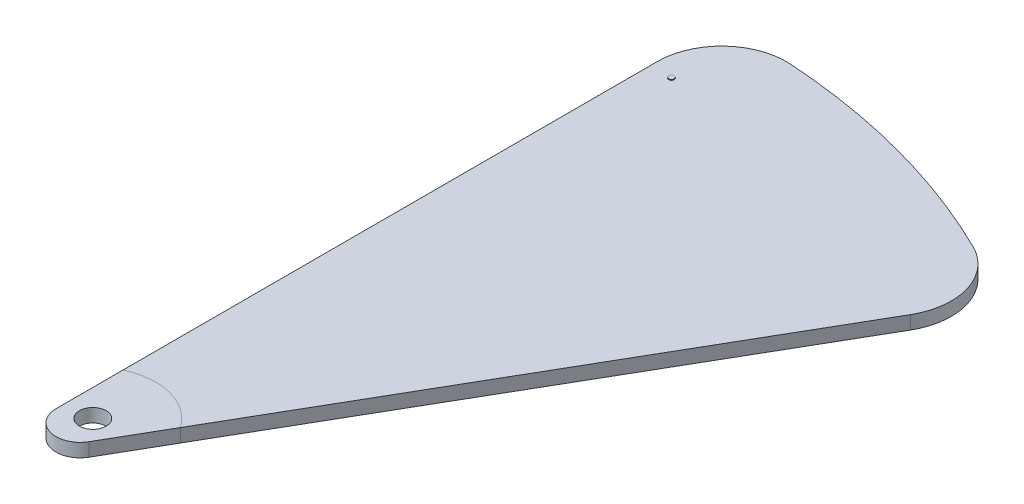
from build123d import *
from build123d.topology import SkipClean

# Parameters (mm, degrees)
SKETCH1_R           = 50
BOSS_EXTRUDE1_DEPTH = 50
SKETCH4_R           = 10
BOSS_EXTRUDE3_DEPTH = 3
CUT_EXTRUDE2_DEPTH  = 0.5
BOSS_EXTRUDE4_DEPTH = 0.2
BOSS_EXTRUDE5_DEPTH = 0.2
BOSS_EXTRUDE6_START = 0.2
SKETCH7_R           = 50
BOSS_EXTRUDE6_DEPTH = 0.2
SCALE1_SCALE        = 0.4


# Read off the part's stored shape, not the designer's step: Boss-Extrude5
with BuildPart() as part:
    # Sketch1 → Boss-Extrude1 (new body)
    with BuildSketch(Plane(origin=(0, 0, 0), x_dir=(1, 0, 0), z_dir=(0, 1, 0))):
        with BuildLine():
            Line((-100, -37.320508076), (-100, 2205.561153086))
            ThreePointArc((-100, 2205.561153086), (-24.242398944, 2380.559537047), (155.20361991, 2445.079106362))
            ThreePointArc((155.20361991, 2445.079106362), (634.106660501, 2366.518274408), (1088.12927558, 2195.102430327))
            ThreePointArc((1088.12927558, 2195.102430327), (1211.274301858, 2049.503834832), (1189.383116921, 1860.071988172))
            Line((1189.383116921, 1860.071988172), (67.942286341, -82.320508076))
            ThreePointArc((67.942286341, -82.320508076), (-33.293714059, -124.253832442), (-100, -37.320508076))
        make_face()
        with Locations(Location((0, 0, 0), (0, 0, 270))):
            Circle(SKETCH1_R, mode=Mode.SUBTRACT)
    extrude(amount=BOSS_EXTRUDE1_DEPTH)

    # Sketch4 → Boss-Extrude3 (add)
    with BuildSketch(Plane(origin=(0, 50, 0), x_dir=(1, 0, 0), z_dir=(0, 1, 0))):
        with Locations(Location((-20, 2177.943552918, 0), (0, 0, 270))):
            Circle(SKETCH4_R)
    extrude(amount=BOSS_EXTRUDE3_DEPTH)

    # Sketch3 → Cut-Extrude2 (cut)
    with BuildSketch(Plane.XZ):
        with BuildLine():
            ThreePointArc((-20.091825873, -2187.943131309), (596.52071885, -2105.151267556), (1164.905031596, -1852.15957592))
            ThreePointArc((1164.905031596, -1852.15957592), (1168.045997919, -1838.370655347), (1154.257077346, -1835.229689025))
            ThreePointArc((1154.257077346, -1835.229689025), (591.068149626, -2085.90887974), (-19.908174127, -2167.943974526))
            ThreePointArc((-19.908174127, -2167.943974526), (-29.999578392, -2177.851727045), (-20.091825873, -2187.943131309))
        make_face()
    extrude(amount=-CUT_EXTRUDE2_DEPTH, mode=Mode.SUBTRACT)

    # Sketch5 → Boss-Extrude4 (add)
    with BuildSketch(Plane.XZ):
        Polygon((542.547945003, -2273.925316947), (586.315782382, -2349.733435026), (767.353015686, -2247.606927353), (794.77422197, -2295.101849842), (801.604348989, -2296.931976861), (981.604348989, -2193.008928407), (1105.934476008, -2121.226896104), (1078.27364816, -2073.316936892), (1198.27364816, -2004.034904589), (166.83416305, -217.529311446), (38.173909012, -291.811343748), (121.032197487, -435.326109216), (-58.967802513, -539.24915767), (61.032197487, -747.095254578), (-58.967802513, -816.377286881), (81.037336135, -1058.87330034), (-38.962663865, -1128.155332642), (89.271984354, -1350.264258649), (-30.728015646, -1419.546290952), (69.606816867, -1593.331318633), (-50.393183133, -1662.613350936), (59.706400881, -1853.31142434), (-55.9634721, -1920.093456643), (-60.293599119, -1922.593456643), (21.112159322, -2063.592366291), (-98.887840678, -2132.874398594), (36.804486202, -2367.900402947), (96.804486202, -2333.259386796), (134.304486202, -2398.21129208), (141.134613221, -2400.041419098), (256.804486202, -2333.259386796), (302.547945003, -2412.489381553), align=None)
        Polygon((191.804486202, -2359.240148909), (140.46474024, -2388.881165061), (-25.22758664, -2101.89363648), (26.112159322, -2072.252620329), align=None, mode=Mode.SUBTRACT)
        Polygon((91.804486202, -2324.599132758), (40.46474024, -2354.240148909), (-85.22758664, -2136.534652631), (-33.887840678, -2106.89363648), align=None, mode=Mode.SUBTRACT)
        Polygon((74.692451525, -750.755508616), (126.032197487, -721.114492465), (972.27422197, -2186.848674369), (920.934476008, -2216.489690521), align=None, mode=Mode.SUBTRACT)
        Polygon((14.692451525, -785.396524767), (66.032197487, -755.755508616), (912.27422197, -2221.489690521), (860.934476008, -2251.130706672), align=None, mode=Mode.SUBTRACT)
        Polygon((74.692451525, -473.627379405), (126.032197487, -443.986363254), (1092.27422197, -2117.566642067), (1040.934476008, -2147.207658218), align=None, mode=Mode.SUBTRACT)
        Polygon((14.692451525, -508.268395556), (66.032197487, -478.627379405), (1032.27422197, -2152.207658218), (980.934476008, -2181.848674369), align=None, mode=Mode.SUBTRACT)
        Polygon((4.706400881, -1896.612694529), (-46.633345081, -1926.253710681), (29.77241336, -2058.592366291), (81.112159322, -2028.951350139), align=None, mode=Mode.SUBTRACT)
        Polygon((710.717180166, -2268.074847309), (762.352766652, -2238.946241976), (86.037336135, -1067.533554377), (34.697590173, -1097.174570529), align=None, mode=Mode.SUBTRACT)
        Polygon((486.20819904, -2294.906079061), (537.547945003, -2265.265062909), (34.271984354, -1393.565528838), (-17.067761608, -1423.20654499), align=None, mode=Mode.SUBTRACT)
        Polygon((650.371435731, -2302.117016533), (702.007022217, -2272.9884112), (26.037336135, -1102.174570529), (-25.302409827, -1131.81558668), align=None, mode=Mode.SUBTRACT)
        Polygon((357.547945003, -2369.188111363), (306.20819904, -2398.829127515), (13.366654919, -1891.612694529), (64.706400881, -1861.971678378), align=None, mode=Mode.SUBTRACT)
        Polygon((86.112159322, -2037.611604177), (251.804486202, -2324.599132758), (200.46474024, -2354.240148909), (34.77241336, -2067.252620329), align=None, mode=Mode.SUBTRACT)
        Polygon((42.932238392, -1388.565528838), (94.271984354, -1358.924512687), (641.661277783, -2307.030580425), (590.025691297, -2336.159185758), align=None, mode=Mode.SUBTRACT)
        Polygon((-36.732929095, -1666.273604974), (366.20819904, -2364.188111363), (417.547945003, -2334.547095212), (14.606816867, -1636.632588823), align=None, mode=Mode.SUBTRACT)
        Polygon((112.92217463, -262.715072971), (164.261920592, -233.07405682), (1184.613394122, -2000.374650551), (1133.27364816, -2030.015666702), align=None, mode=Mode.SUBTRACT)
        Polygon((104.401991454, -267.957682821), (1124.613394122, -2035.015666702), (1073.27364816, -2064.656682854), (53.062245492, -297.598698973), align=None, mode=Mode.SUBTRACT)
        Polygon((6.032197487, -513.268395556), (121.032197487, -712.454238427), (69.692451525, -742.095254578), (-45.307548475, -542.909411708), align=None, mode=Mode.SUBTRACT)
        Polygon((6.032197487, -790.396524767), (852.27422197, -2256.130706672), (800.934476008, -2285.771722823), (-45.307548475, -820.037540919), align=None, mode=Mode.SUBTRACT)
        Polygon((23.267070905, -1631.632588823), (426.20819904, -2329.547095212), (477.547945003, -2299.906079061), (74.606816867, -1601.991572671), align=None, mode=Mode.SUBTRACT)
    extrude(amount=-BOSS_EXTRUDE4_DEPTH)

    # Boss-Extrude5 outline → Boss-Extrude5 (add)
    with BuildSketch(Plane.XZ):
        with BuildLine():
            ThreePointArc((234.09429984, -2155.360125562), (239.520378802, -2154.763885028), (244.944939335, -2154.153984462))
            Line((244.944939335, -2154.153984462), (-36.732929095, -1666.273604974))
            Line((-36.732929095, -1666.273604974), (14.606816867, -1636.632588823))
            Line((14.606816867, -1636.632588823), (308.661879703, -2145.950897877))
            ThreePointArc((308.661879703, -2145.950897877), (313.98647166, -2145.178292752), (319.309129869, -2144.392476126))
            Line((319.309129869, -2144.392476126), (23.267070905, -1631.632588823))
            Line((23.267070905, -1631.632588823), (74.606816867, -1601.991572671))
            Line((74.606816867, -1601.991572671), (381.845295224, -2134.144227225))
            ThreePointArc((381.845295224, -2134.144227225), (387.072476461, -2133.202360314), (392.297334581, -2132.247690434))
            Line((392.297334581, -2132.247690434), (-17.067761608, -1423.20654499))
            Line((-17.067761608, -1423.20654499), (34.271984354, -1393.565528838))
            Line((34.271984354, -1393.565528838), (453.697623881, -2120.032046495))
            ThreePointArc((453.697623881, -2120.032046495), (458.830885306, -2118.926999868), (463.961455319, -2117.809524027))
            Line((463.961455319, -2117.809524027), (42.932238392, -1388.565528838))
            Line((42.932238392, -1388.565528838), (94.271984354, -1358.924512687))
            Line((94.271984354, -1358.924512687), (524.264288743, -2103.693030751))
            ThreePointArc((524.264288743, -2103.693030751), (529.306614784, -2102.430003502), (534.345898088, -2101.154890359))
            Line((534.345898088, -2101.154890359), (-25.302409827, -1131.81558668))
            Line((-25.302409827, -1131.81558668), (26.037336135, -1102.174570529))
            Line((26.037336135, -1102.174570529), (593.584056893, -2085.194326552))
            ThreePointArc((593.584056893, -2085.194326552), (598.537988348, -2083.777744527), (603.488539208, -2082.349393144))
            Line((603.488539208, -2082.349393144), (34.697590173, -1097.174570529))
            Line((34.697590173, -1097.174570529), (86.037336135, -1067.533554377))
            Line((86.037336135, -1067.533554377), (661.689835953, -2064.592931567))
            ThreePointArc((661.689835953, -2064.592931567), (666.557520224, -2063.026535049), (671.42149647, -2061.448662024))
            Line((671.42149647, -2061.448662024), (-45.307548475, -820.037540919))
            Line((-45.307548475, -820.037540919), (6.032197487, -790.396524767))
            Line((6.032197487, -790.396524767), (728.609310762, -2041.936797345))
            ThreePointArc((728.609310762, -2041.936797345), (733.392542002, -2040.22371112), (738.17174553, -2038.499420207))
            Line((738.17174553, -2038.499420207), (14.692451525, -785.396524767))
            Line((14.692451525, -785.396524767), (66.032197487, -755.755508616))
            Line((66.032197487, -755.755508616), (794.365451405, -2017.265709245))
            ThreePointArc((794.365451405, -2017.265709245), (799.065702466, -2015.40849835), (803.761611449, -2013.540335837))
            Line((803.761611449, -2013.540335837), (74.692451525, -750.755508616))
            Line((74.692451525, -750.755508616), (126.032197487, -721.114492465))
            Line((126.032197487, -721.114492465), (858.976915854, -1990.611983816))
            ThreePointArc((858.976915854, -1990.611983816), (863.595363434, -1988.612697419), (868.209157673, -1986.602695713))
            Line((868.209157673, -1986.602695713), (14.692451525, -508.268395556))
            Line((14.692451525, -508.268395556), (66.032197487, -478.627379405))
            Line((66.032197487, -478.627379405), (922.458364554, -1962.001013696))
            ThreePointArc((922.458364554, -1962.001013696), (926.995908595, -1959.861218946), (931.528489064, -1957.710930179))
            Line((931.528489064, -1957.710930179), (74.692451525, -473.627379405))
            Line((74.692451525, -473.627379405), (126.032197487, -443.986363254))
            Line((126.032197487, -443.986363254), (984.820699868, -1931.451682334))
            ThreePointArc((984.820699868, -1931.451682334), (989.277977987, -1929.172489528), (993.729981352, -1926.883010523))
            Line((993.729981352, -1926.883010523), (53.062245492, -297.598698973))
            Line((53.062245492, -297.598698973), (104.401991454, -267.957682821))
            Line((104.401991454, -267.957682821), (1046.071239752, -1898.976664798))
            ThreePointArc((1046.071239752, -1898.976664798), (1050.448637241, -1896.558744832), (1054.820445911, -1894.130734392))
            Line((1054.820445911, -1894.130734392), (112.92217463, -262.715072971))
            Line((112.92217463, -262.715072971), (164.261920592, -233.07405682))
            Line((164.261920592, -233.07405682), (1106.213832235, -1864.582626073))
            ThreePointArc((1106.213832235, -1864.582626073), (1110.511488019, -1862.02622083), (1114.803236108, -1859.459909986))
            Line((1114.803236108, -1859.459909986), (166.83416305, -217.529311446))
            Line((166.83416305, -217.529311446), (38.173909012, -291.811343748))
            Line((38.173909012, -291.811343748), (121.032197487, -435.326109216))
            Line((121.032197487, -435.326109216), (-58.967802513, -539.24915767))
            Line((-58.967802513, -539.24915767), (61.032197487, -747.095254578))
            Line((61.032197487, -747.095254578), (-58.967802513, -816.377286881))
            Line((-58.967802513, -816.377286881), (81.037336135, -1058.87330034))
            Line((81.037336135, -1058.87330034), (-38.962663865, -1128.155332642))
            Line((-38.962663865, -1128.155332642), (89.271984354, -1350.264258649))
            Line((89.271984354, -1350.264258649), (-30.728015646, -1419.546290952))
            Line((-30.728015646, -1419.546290952), (69.606816867, -1593.331318633))
            Line((69.606816867, -1593.331318633), (-50.393183133, -1662.613350936))
            Line((-50.393183133, -1662.613350936), (59.706400881, -1853.31142434))
            Line((59.706400881, -1853.31142434), (-60.293599119, -1922.593456643))
            Line((-60.293599119, -1922.593456643), (21.112159322, -2063.592366291))
            Line((21.112159322, -2063.592366291), (-98.887840678, -2132.874398594))
            Line((-98.887840678, -2132.874398594), (36.804486202, -2367.900402947))
            Line((36.804486202, -2367.900402947), (96.804486202, -2333.259386796))
            Line((96.804486202, -2333.259386796), (134.304486202, -2398.21129208))
            Line((134.304486202, -2398.21129208), (141.134613221, -2400.041419098))
            Line((141.134613221, -2400.041419098), (256.804486202, -2333.259386796))
            Line((256.804486202, -2333.259386796), (302.547945003, -2412.489381553))
            Line((302.547945003, -2412.489381553), (542.547945003, -2273.925316947))
            Line((542.547945003, -2273.925316947), (586.315782382, -2349.733435026))
            Line((586.315782382, -2349.733435026), (767.353015686, -2247.606927353))
            Line((767.353015686, -2247.606927353), (794.77422197, -2295.101849842))
            Line((794.77422197, -2295.101849842), (801.604348989, -2296.931976861))
            Line((801.604348989, -2296.931976861), (1105.934476008, -2121.226896104))
            Line((1105.934476008, -2121.226896104), (1078.27364816, -2073.316936892))
            Line((1078.27364816, -2073.316936892), (1198.27364816, -2004.034904589))
            Line((1198.27364816, -2004.034904589), (1124.804581071, -1876.782747606))
            ThreePointArc((1124.804581071, -1876.782747606), (1120.512481463, -1879.348452575), (1116.214529453, -1881.904341764))
            Line((1116.214529453, -1881.904341764), (1184.613394122, -2000.374650551))
            Line((1184.613394122, -2000.374650551), (1133.27364816, -2030.015666702))
            Line((1133.27364816, -2030.015666702), (1064.821633527, -1911.453299478))
            ThreePointArc((1064.821633527, -1911.453299478), (1060.450206779, -1913.881967691), (1056.073240703, -1916.300638622))
            Line((1056.073240703, -1916.300638622), (1124.613394122, -2035.015666702))
            Line((1124.613394122, -2035.015666702), (1073.27364816, -2064.656682854))
            Line((1073.27364816, -2064.656682854), (1003.74114875, -1944.222861098))
            ThreePointArc((1003.74114875, -1944.222861098), (999.290264402, -1946.514267808), (994.834149112, -1948.795485183))
            Line((994.834149112, -1948.795485183), (1092.27422197, -2117.566642067))
            Line((1092.27422197, -2117.566642067), (1040.934476008, -2147.207658218))
            Line((1040.934476008, -2147.207658218), (941.559864753, -1975.085782541))
            ThreePointArc((941.559864753, -1975.085782541), (937.029150852, -1977.239286926), (932.493511562, -1979.382398175))
            Line((932.493511562, -1979.382398175), (1032.27422197, -2152.207658218))
            Line((1032.27422197, -2152.207658218), (980.934476008, -2181.848674369))
            Line((980.934476008, -2181.848674369), (878.271156695, -2004.030589245))
            ThreePointArc((878.271156695, -2004.030589245), (873.659994101, -2006.045124622), (869.044210702, -2008.049049987))
            Line((869.044210702, -2008.049049987), (972.27422197, -2186.848674369))
            Line((972.27422197, -2186.848674369), (920.934476008, -2216.489690521))
            Line((920.934476008, -2216.489690521), (813.864935364, -2031.039806182))
            ThreePointArc((813.864935364, -2031.039806182), (809.17244816, -2032.913863509), (804.475645675, -2034.777079394))
            Line((804.475645675, -2034.777079394), (912.27422197, -2221.489690521))
            Line((912.27422197, -2221.489690521), (860.934476008, -2251.130706672))
            Line((860.934476008, -2251.130706672), (748.327489967, -2056.089685561))
            ThreePointArc((748.327489967, -2056.089685561), (743.552531613, -2057.821289627), (738.773566433, -2059.541804589))
            Line((738.773566433, -2059.541804589), (852.27422197, -2256.130706672))
            Line((852.27422197, -2256.130706672), (800.934476008, -2285.771722823))
            Line((800.934476008, -2285.771722823), (681.641269397, -2079.149827974))
            ThreePointArc((681.641269397, -2079.149827974), (676.782404105, -2080.736505376), (671.919845508, -2082.311827878))
            Line((671.919845508, -2082.311827878), (762.352766652, -2238.946241976))
            Line((762.352766652, -2238.946241976), (710.717180166, -2268.074847309))
            Line((710.717180166, -2268.074847309), (613.784593627, -2100.182682515))
            ThreePointArc((613.784593627, -2100.182682515), (608.840072242, -2101.621420176), (603.892178453, -2103.048516824))
            Line((603.892178453, -2103.048516824), (702.007022217, -2272.9884112))
            Line((702.007022217, -2272.9884112), (650.371435731, -2302.117016533))
            Line((650.371435731, -2302.117016533), (544.731283731, -2119.142905949))
            ThreePointArc((544.731283731, -2119.142905949), (539.699013109, -2120.430098485), (534.663700938, -2121.705341043))
            Line((534.663700938, -2121.705341043), (641.661277783, -2307.030580425))
            Line((641.661277783, -2307.030580425), (590.025691297, -2336.159185758))
            Line((590.025691297, -2336.159185758), (474.450195033, -2135.976554118))
            ThreePointArc((474.450195033, -2135.976554118), (469.327699617, -2137.107937771), (464.202506363, -2138.227036682))
            Line((464.202506363, -2138.227036682), (537.547945003, -2265.265062909))
            Line((537.547945003, -2265.265062909), (486.20819904, -2294.906079061))
            Line((486.20819904, -2294.906079061), (402.904632704, -2150.620069714))
            ThreePointArc((402.904632704, -2150.620069714), (397.689006511, -2151.590639832), (392.471042382, -2152.548561172))
            Line((392.471042382, -2152.548561172), (477.547945003, -2299.906079061))
            Line((477.547945003, -2299.906079061), (426.20819904, -2329.547095212))
            Line((426.20819904, -2329.547095212), (330.05162212, -2162.999018503))
            ThreePointArc((330.05162212, -2162.999018503), (324.739468785, -2163.802926499), (319.4253575, -2164.593788288))
            Line((319.4253575, -2164.593788288), (417.547945003, -2334.547095212))
            Line((417.547945003, -2334.547095212), (366.20819904, -2364.188111363))
            Line((366.20819904, -2364.188111363), (255.840996834, -2173.026509652))
            ThreePointArc((255.840996834, -2173.026509652), (250.428354514, -2173.656933963), (245.01415893, -2174.273876317))
            Line((245.01415893, -2174.273876317), (357.547945003, -2369.188111363))
            Line((357.547945003, -2369.188111363), (306.20819904, -2398.829127515))
            Line((306.20819904, -2398.829127515), (180.214253836, -2180.601212974))
            ThreePointArc((180.214253836, -2180.601212974), (174.696500625, -2181.050196575), (169.177629094, -2181.485218177))
            Line((169.177629094, -2181.485218177), (251.804486202, -2324.599132758))
            Line((251.804486202, -2324.599132758), (200.46474024, -2354.240148909))
            Line((200.46474024, -2354.240148909), (103.103107167, -2185.60485372))
            ThreePointArc((103.103107167, -2185.60485372), (97.474841023, -2185.863097881), (91.84592856, -2186.106848422))
            Line((91.84592856, -2186.106848422), (191.804486202, -2359.240148909))
            Line((191.804486202, -2359.240148909), (140.46474024, -2388.881165061))
            Line((140.46474024, -2388.881165061), (24.427644132, -2187.899019039))
            ThreePointArc((24.427644132, -2187.899019039), (18.682528906, -2187.955618934), (12.937284864, -2187.99713299))
            Line((12.937284864, -2187.99713299), (91.804486202, -2324.599132758))
            Line((91.804486202, -2324.599132758), (40.46474024, -2354.240148909))
            Line((40.46474024, -2354.240148909), (-85.22758664, -2136.534652631))
            Line((-85.22758664, -2136.534652631), (-33.887840678, -2106.89363648))
            Line((-33.887840678, -2106.89363648), (1.412096317, -2168.034920859))
            ThreePointArc((1.412096317, -2168.034920859), (7.174614427, -2168.023509326), (12.937081851, -2167.996781362))
            Line((12.937081851, -2167.996781362), (-25.22758664, -2101.89363648))
            Line((-25.22758664, -2101.89363648), (26.112159322, -2072.252620329))
            Line((26.112159322, -2072.252620329), (80.548181377, -2166.538576291))
            ThreePointArc((80.548181377, -2166.538576291), (86.192330009, -2166.321373741), (91.835893615, -2166.089467387))
            Line((91.835893615, -2166.089467387), (34.77241336, -2067.252620329))
            Line((34.77241336, -2067.252620329), (86.112159322, -2037.611604177))
            Line((86.112159322, -2037.611604177), (158.080566142, -2162.264541329))
            ThreePointArc((158.080566142, -2162.264541329), (163.612893388, -2161.8529629), (169.144149368, -2161.427229591))
            Line((169.144149368, -2161.427229591), (13.366654919, -1891.612694529))
            Line((13.366654919, -1891.612694529), (64.706400881, -1861.971678378))
            Line((64.706400881, -1861.971678378), (234.09429984, -2155.360125562))
        make_face()
        Polygon((29.77241336, -2058.592366291), (-46.633345081, -1926.253710681), (4.706400881, -1896.612694529), (81.112159322, -2028.951350139), align=None, mode=Mode.SUBTRACT)
        Polygon((121.032197487, -712.454238427), (69.692451525, -742.095254578), (-45.307548475, -542.909411708), (6.032197487, -513.268395556), align=None, mode=Mode.SUBTRACT)
    extrude(amount=BOSS_EXTRUDE5_DEPTH)

    # Sketch7 → Boss-Extrude6 (add)
    with SkipClean():  # the faces are left unmerged after this step: merging them gives an invalid solid
        with BuildSketch(Plane.XZ.offset(BOSS_EXTRUDE6_START)):
            with BuildLine():
                ThreePointArc((67.942286341, 82.320508076), (-33.293714059, 124.253832442), (-100, 37.320508076))
                Line((-100, 37.320508076), (-100, -212.402391201))
                ThreePointArc((-100, -212.402391201), (60.761747143, -226.765927494), (192.803735979, -133.945866605))
                Line((192.803735979, -133.945866605), (67.942286341, 82.320508076))
            make_face()
            Circle(SKETCH7_R, mode=Mode.SUBTRACT)
        extrude(amount=-BOSS_EXTRUDE6_DEPTH)


with BuildPart() as part_1:
    # Scale1: scaled about (385.842398833, 24.987125584, -1440.005927683)
    add(part.part.scale(SCALE1_SCALE).moved(Location((231.5054393, 14.99227535, -864.00355661))))


solid = part_1.part
